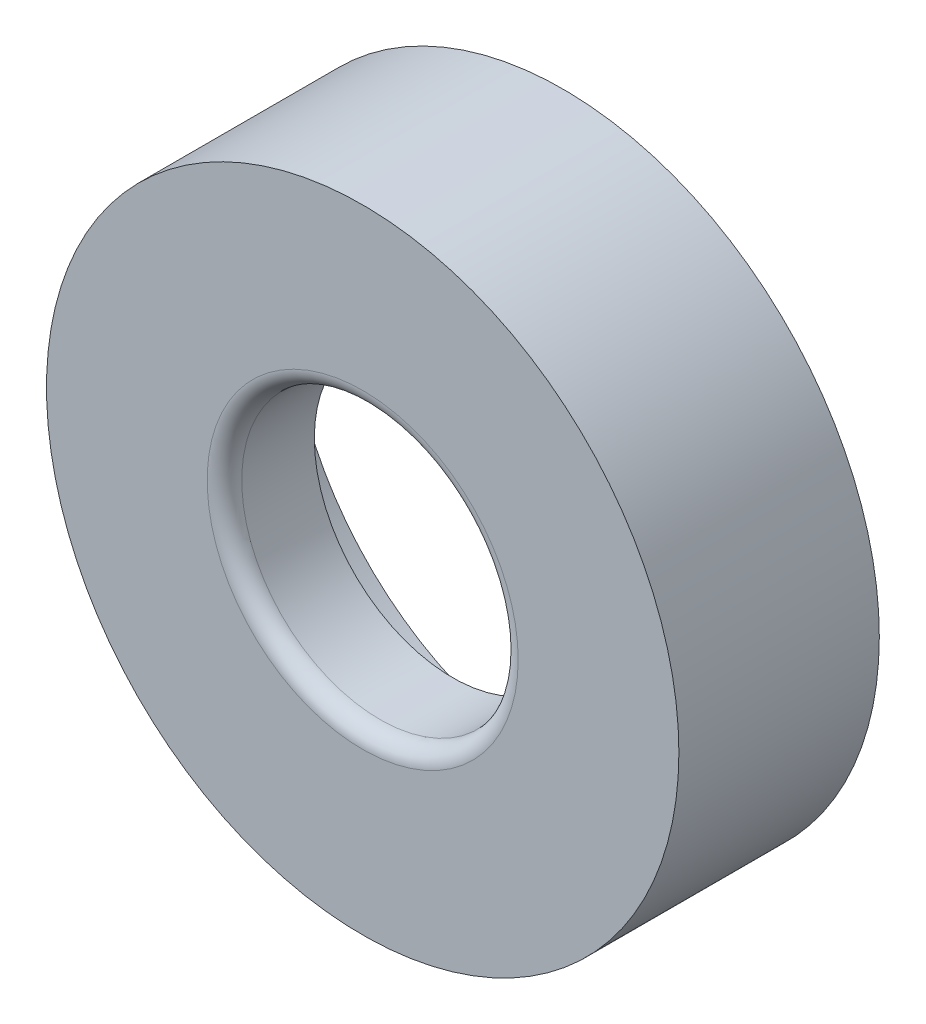
from build123d import *

# Parameters (mm, degrees)
SKETCH1_R           = 9.15
BOSS_EXTRUDE1_DEPTH = 5.8
SKETCH2_R           = 4
CUT_EXTRUDE1_DEPTH  = 96.162543124
SKETCH3_R           = 7.925
CUT_EXTRUDE2_DEPTH  = 3.2
FILLET1_R           = 0.5


with BuildPart() as part:
    # Sketch1 → Boss-Extrude1 (new body)
    with BuildSketch(Plane.XY):
        with Locations((85.206527413, -1.763997815)):
            Circle(SKETCH1_R)
    extrude(amount=BOSS_EXTRUDE1_DEPTH)

    # Sketch2 → Cut-Extrude1 (cut, through all)
    with BuildSketch(Plane.XY.offset(5.8)):
        with Locations((85.206527413, -1.763997815)):
            Circle(SKETCH2_R)
    extrude(amount=-CUT_EXTRUDE1_DEPTH, mode=Mode.SUBTRACT)

    # Sketch3 → Cut-Extrude2 (cut)
    with BuildSketch(Plane(origin=(0, 0, 0), x_dir=(-1, 0, 0), z_dir=(0, 0, -1))):
        with Locations((-85.206527413, -1.763997815)):
            Circle(SKETCH3_R)
    extrude(amount=-CUT_EXTRUDE2_DEPTH, mode=Mode.SUBTRACT)

    # Fillet1
    fillet1_edges = [part.edges().sort_by_distance(p)[0] for p in [
        (81.206527413, -1.763997815, 5.8),
    ]]
    fillet(fillet1_edges, radius=FILLET1_R)


solid = part.part
